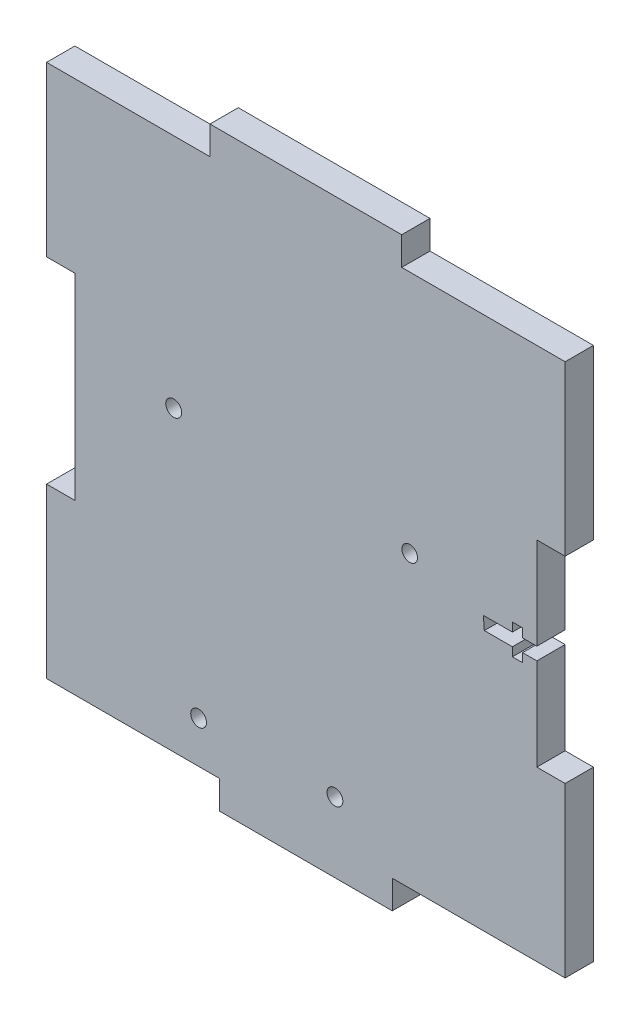
from build123d import *

# Parameters (mm, degrees)
SKETCH1_W           = 106.1212
SKETCH1_H           = 120.8024
BOSS_EXTRUDE1_DEPTH = 5.7912
CAVITY2_START       = -53.0606
CAVITY2_OUTLINE_W   = 5.7912
CAVITY2_OUTLINE_H   = 5.7912
CAVITY2_DEPTH       = 35.373733333
CAVITY2_START_2     = 17.686866667
CAVITY2_2_OUTLINE_W = 5.7912
CAVITY2_2_OUTLINE_H = 5.7912
CAVITY2_2_DEPTH     = 35.373733333
SKETCH6_W           = 33.443333333
SKETCH6_H           = 5.7912
CUT_EXTRUDE4_DEPTH  = 81.605646398
SKETCH4_W           = 2.0828
SKETCH4_H           = 6.1722
CUT_EXTRUDE5_DEPTH  = 81.605646398
CUT_EXTRUDE6_DEPTH  = 81.605646398
SKETCH2_W           = 5.7912
SKETCH2_H           = 40.267466666
CUT_EXTRUDE7_DEPTH  = 81.605646398
SKETCH7_R           = 1.615828467
SKETCH7_R_2         = 1.628881449
SKETCH7_R_3         = 1.612957286
SKETCH7_R_4         = 1.6
CUT_EXTRUDE8_DEPTH  = 81.605646398


# Read off the part's stored shape, not the designer's step: Cavity2
with BuildPart() as part:
    # Sketch1 → Boss-Extrude1 (new body)
    with BuildSketch(Plane.XY):
        Rectangle(SKETCH1_W, SKETCH1_H)
    extrude(amount=BOSS_EXTRUDE1_DEPTH)

    # Cavity2 outline → Cavity2 (cut)
    with BuildSketch(Plane.YZ.offset(CAVITY2_START)):
        with Locations((-57.5056, 2.8956)):
            Rectangle(CAVITY2_OUTLINE_W, CAVITY2_OUTLINE_H)
    extrude(amount=CAVITY2_DEPTH, mode=Mode.SUBTRACT)

    # Cavity2 2 outline → Cavity2 2 (cut)
    with BuildSketch(Plane.YZ.offset(CAVITY2_START_2)):
        with Locations((-57.5056, 2.8956)):
            Rectangle(CAVITY2_2_OUTLINE_W, CAVITY2_2_OUTLINE_H)
    extrude(amount=CAVITY2_2_DEPTH, mode=Mode.SUBTRACT)

    # Sketch6 → Cut-Extrude4 (cut, through all)
    with BuildSketch(Plane(origin=(0, 0, 0), x_dir=(-1, 0, 0), z_dir=(0, 0, -1))):
        with Locations((-36.338933334, 57.5056)):
            Rectangle(SKETCH6_W, SKETCH6_H)
        with Locations((36.338933334, 57.5056)):
            Rectangle(SKETCH6_W, SKETCH6_H)
    extrude(amount=-CUT_EXTRUDE4_DEPTH, mode=Mode.SUBTRACT)

    # Sketch4 → Cut-Extrude5 (cut, through all)
    with BuildSketch(Plane(origin=(0, 0, 0), x_dir=(-1, 0, 0), z_dir=(0, 0, -1))):
        with Locations((-43.307, 0)):
            Rectangle(SKETCH4_W, SKETCH4_H)
    extrude(amount=-CUT_EXTRUDE5_DEPTH, mode=Mode.SUBTRACT)

    # Sketch3 → Cut-Extrude6 (cut, through all)
    with BuildSketch(Plane(origin=(0, 0, 0), x_dir=(-1, 0, 0), z_dir=(0, 0, -1))):
        Polygon((-50.0888, 1.30175), (-50.0888, -1.30175), (-36.5252, -1.30175), (-36.322002291, 1.29380831), align=None)
    extrude(amount=-CUT_EXTRUDE6_DEPTH, mode=Mode.SUBTRACT)

    # Sketch2 → Cut-Extrude7 (cut, through all)
    with BuildSketch(Plane(origin=(0, 0, 0), x_dir=(-1, 0, 0), z_dir=(0, 0, -1))):
        with Locations((-50.165, 0)):
            Rectangle(SKETCH2_W, SKETCH2_H)
        with Locations((50.165, 0)):
            Rectangle(SKETCH2_W, SKETCH2_H)
    extrude(amount=-CUT_EXTRUDE7_DEPTH, mode=Mode.SUBTRACT)

    # Sketch7 → Cut-Extrude8 (cut, through all)
    with BuildSketch(Plane.XY.offset(5.7912)):
        with Locations((5.9544, -46.06)):
            Circle(SKETCH7_R)
        with Locations((-27.0456, 6.34)):
            Circle(SKETCH7_R_2)
        with Locations((-21.9456, -46.06)):
            Circle(SKETCH7_R_3)
        with Locations((21.2544, 4.74)):
            Circle(SKETCH7_R_4)
    extrude(amount=-CUT_EXTRUDE8_DEPTH, mode=Mode.SUBTRACT)


solid = part.part
